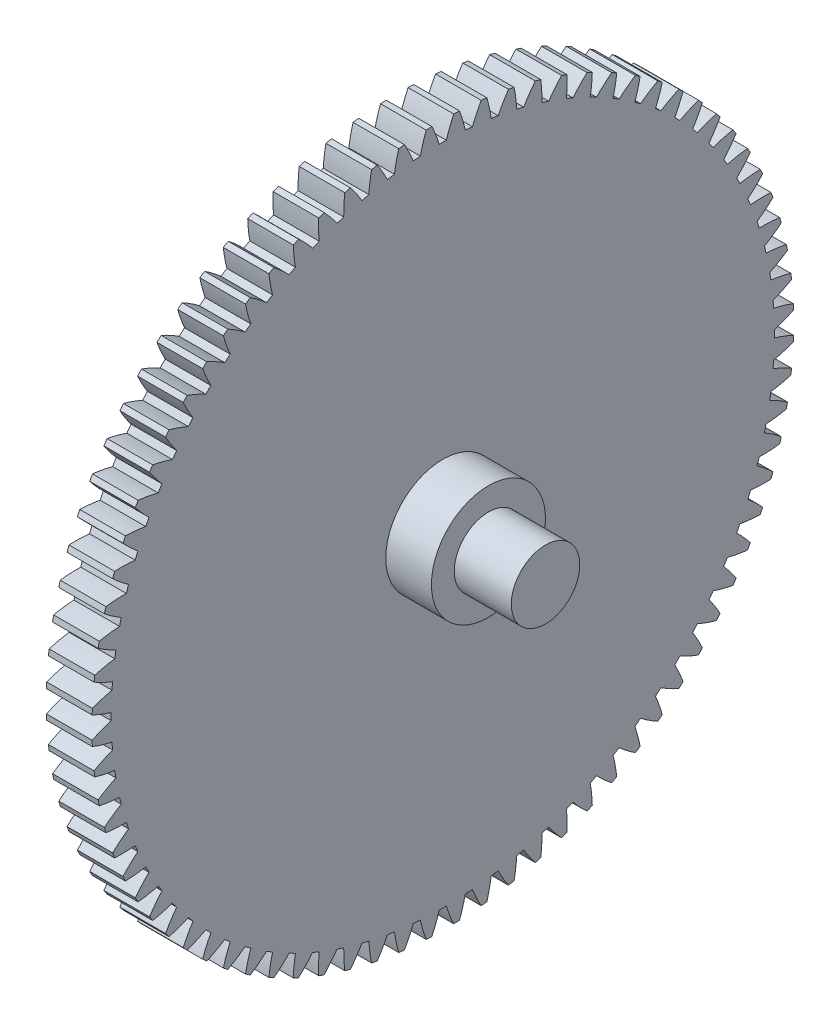
from build123d import *

# Parameters (mm, degrees)
BASPROSKE_W              = 8
BASPROSKE_H              = 61.5
TOOTHCUT_DEPTH           = 88.341284625
TEETHCUTS_COUNT          = 80
TEETHCUTS_ANGLE          = 355.5
BORSKE_R                 = 5
BORE_DEPTH               = 50.0000508
ESBO_O1_R                = 10
RESSALTO_EXTRUS_O1_DEPTH = 8
ESBO_O2_R                = 6
RESSALTO_EXTRUS_O2_DEPTH = 10


with BuildPart() as part:
    # BasProSke → Base-Revolve (revolve)
    with BuildSketch(Plane(origin=(0, 0, 0), x_dir=(1, 0, 0), z_dir=(0, 1, 0))):
        with Locations((4, 30.75)):
            Rectangle(BASPROSKE_W, BASPROSKE_H)
    revolve(axis=Axis((-10, 0, 0), (1, 0, 0)))

    # TooCutSke → ToothCut (cut, through all)
    with BuildSketch(Plane(origin=(0, 0, 0), x_dir=(0, 0, -1), z_dir=(1, 0, 0))):
        with BuildLine():
            ThreePointArc((0.624201484, 58.120648211), (0, 58.124), (-0.624201484, 58.120648211))
            ThreePointArc((-0.624201484, 58.120648211), (-1.21079476, 59.832499178), (-1.924699975, 61.495287422))
            ThreePointArc((-1.924699975, 61.495287422), (0, 61.5254), (1.924699975, 61.495287422))
            ThreePointArc((1.924699975, 61.495287422), (1.21079476, 59.832499178), (0.624201484, 58.120648211))
        make_face()
    toothcut = extrude(amount=TOOTHCUT_DEPTH, mode=Mode.SUBTRACT)

    # TeethCuts: ToothCut ×80 about axis
    teethcuts_axis = Axis((-10, 0, 0), (1, 0, 0))
    for i in range(1, TEETHCUTS_COUNT):
        add(toothcut.rotate(teethcuts_axis, i * TEETHCUTS_ANGLE / (TEETHCUTS_COUNT - 1)), mode=Mode.SUBTRACT)

    # BorSke → Bore (cut, symmetric)
    with BuildSketch(Plane(origin=(0, 0, 0), x_dir=(0, 0, -1), z_dir=(1, 0, 0))):
        Circle(BORSKE_R)
    extrude(amount=BORE_DEPTH, both=True, mode=Mode.SUBTRACT)

    # Esboço1 → Ressalto-extrusão1 (add)
    with BuildSketch(Plane(origin=(8, 0, 0), x_dir=(0, 0, -1), z_dir=(1, 0, 0))):
        Circle(ESBO_O1_R)
    extrude(amount=RESSALTO_EXTRUS_O1_DEPTH)

    # Esboço2 → Ressalto-extrusão2 (add)
    with BuildSketch(Plane(origin=(16, 0, 0), x_dir=(0, 0, -1), z_dir=(1, 0, 0))):
        Circle(ESBO_O2_R)
    extrude(amount=RESSALTO_EXTRUS_O2_DEPTH)


solid = part.part
